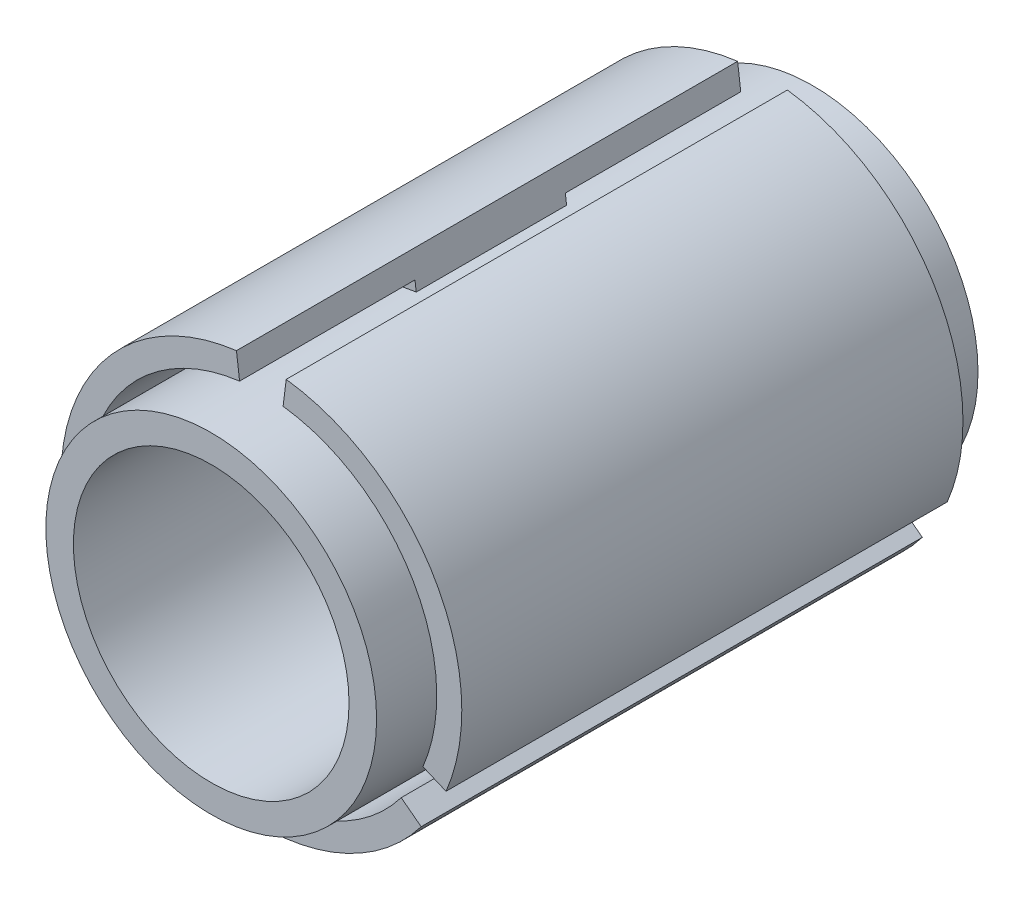
from build123d import *

# Parameters (mm, degrees)
CROQUIS1_R                 = 33
SALIENTE_EXTRUIR1_DEPTH    = 15
SALIENTE_EXTRUIR2_DEPTH    = 15
SALIENTE_EXTRUIR3_DEPTH    = 50
CROQUIS4_R                 = 33
SALIENTE_EXTRUIR4_DEPTH    = 60
CROQUIS5_R                 = 27.5
CORTAR_EXTRUIR1_DEPTH      = 40
CORTAR_EXTRUIR2_START      = -75
CROQUIS6_R                 = 27.5
CORTAR_EXTRUIR2_DEPTH      = 75
CORTAR_EXTRUIR3_DEPTH      = 83.462112512
CORTAR_EXTRUIR3_DEPTH_BACK = 83.462112512
CROQUIS7_R                 = 1


with BuildPart() as part:
    # Croquis1 → Saliente-Extruir1 (new, symmetric)
    with BuildSketch(Plane.XY):
        Circle(CROQUIS1_R)
    extrude(amount=SALIENTE_EXTRUIR1_DEPTH, both=True)

    # Croquis2 → Saliente-Extruir2 (add, symmetric)
    with BuildSketch(Plane.XY):
        with BuildLine():
            Line((-4.961389384, 39.691115069), (-4.093146241, 32.745169932))
            ThreePointArc((-4.093146241, 32.745169932), (-28.578838325, 16.5), (-30.404722133, -12.827816339))
            Line((-30.404722133, -12.827816339), (-36.854208646, -15.54886829))
            ThreePointArc((-36.854208646, -15.54886829), (-34.641016151, 20), (-4.961389384, 39.691115069))
        make_face()
        with BuildLine():
            Line((4.961389384, 39.691115069), (4.093146241, 32.745169932))
            ThreePointArc((4.093146241, 32.745169932), (28.578838325, 16.5), (30.404722133, -12.827816339))
            Line((30.404722133, -12.827816339), (36.854208646, -15.54886829))
            ThreePointArc((36.854208646, -15.54886829), (34.641016151, 20), (4.961389384, 39.691115069))
        make_face()
        with BuildLine():
            Line((31.892819262, -24.142246779), (26.311575891, -19.917353592))
            ThreePointArc((26.311575891, -19.917353592), (0, -33), (-26.311575891, -19.917353592))
            Line((-26.311575891, -19.917353592), (-31.892819262, -24.142246779))
            ThreePointArc((-31.892819262, -24.142246779), (0, -40), (31.892819262, -24.142246779))
        make_face()
    extrude(amount=SALIENTE_EXTRUIR2_DEPTH, both=True)

    # Croquis3 → Saliente-Extruir3 (add, symmetric)
    with BuildSketch(Plane.XY):
        with BuildLine():
            Line((-4.341215711, 34.729725685), (-4.961389384, 39.691115069))
            ThreePointArc((-4.961389384, 39.691115069), (-34.641016151, 20), (-36.854208646, -15.54886829))
            Line((-36.854208646, -15.54886829), (-32.247432565, -13.605259754))
            ThreePointArc((-32.247432565, -13.605259754), (-30.310889132, 17.5), (-4.341215711, 34.729725685))
        make_face()
        with BuildLine():
            Line((4.341215711, 34.729725685), (4.961389384, 39.691115069))
            ThreePointArc((4.961389384, 39.691115069), (34.641016151, 20), (36.854208646, -15.54886829))
            Line((36.854208646, -15.54886829), (32.247432565, -13.605259754))
            ThreePointArc((32.247432565, -13.605259754), (30.310889132, 17.5), (4.341215711, 34.729725685))
        make_face()
        with BuildLine():
            Line((31.892819262, -24.142246779), (27.906216854, -21.124465931))
            ThreePointArc((27.906216854, -21.124465931), (0, -35), (-27.906216854, -21.124465931))
            Line((-27.906216854, -21.124465931), (-31.892819262, -24.142246779))
            ThreePointArc((-31.892819262, -24.142246779), (0, -40), (31.892819262, -24.142246779))
        make_face()
    extrude(amount=SALIENTE_EXTRUIR3_DEPTH, both=True)

    # Croquis4 → Saliente-Extruir4 (add, symmetric)
    with BuildSketch(Plane.XY):
        Circle(CROQUIS4_R)
    extrude(amount=SALIENTE_EXTRUIR4_DEPTH, both=True)

    # Croquis5 → Cortar-Extruir1 (cut)
    with BuildSketch(Plane.XY.offset(60)):
        Circle(CROQUIS5_R)
    extrude(amount=-CORTAR_EXTRUIR1_DEPTH, mode=Mode.SUBTRACT)

    # Croquis6 → Cortar-Extruir2 (cut)
    with BuildSketch(Plane(origin=(0, 0, -60), x_dir=(-1, 0, 0), z_dir=(0, 0, -1)).offset(CORTAR_EXTRUIR2_START)):
        Circle(CROQUIS6_R)
    extrude(amount=CORTAR_EXTRUIR2_DEPTH, mode=Mode.SUBTRACT)

    # Croquis7 → Cortar-Extruir3 (cut, two sides: drawn at the far end of the back side and taken through both)
    with BuildSketch(Plane.XY.offset(-CORTAR_EXTRUIR3_DEPTH_BACK)):
        with Locations((5, 5)):
            Circle(CROQUIS7_R)
        with Locations((-5, 5)):
            Circle(CROQUIS7_R)
        with Locations((-5, -5)):
            Circle(CROQUIS7_R)
        with Locations((5, -5)):
            Circle(CROQUIS7_R)
    extrude(amount=CORTAR_EXTRUIR3_DEPTH + CORTAR_EXTRUIR3_DEPTH_BACK, mode=Mode.SUBTRACT)


solid = part.part
